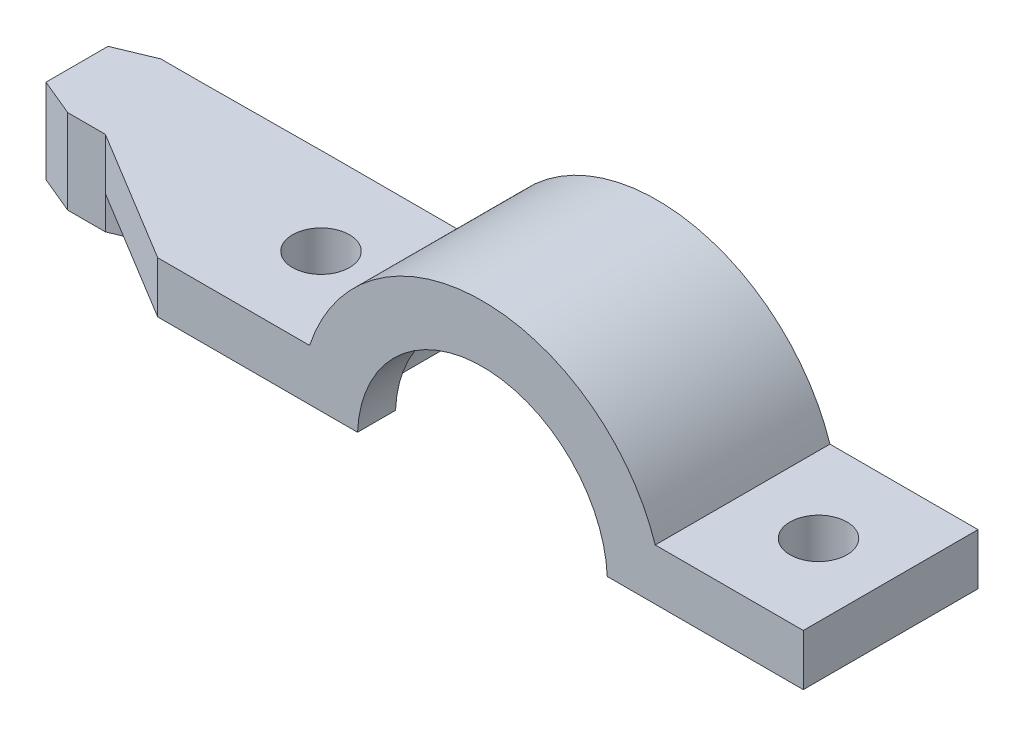
from build123d import *

# Parameters (mm, degrees)
REVOLVE_1_ANGLE       = 180
SKETCH_3_W            = 9
SKETCH_3_H            = 9.2
SKETCH_3_R            = 1.5
EXTRUDE_2_DEPTH       = 3
MOVE_FACE_1_OUTLINE_W = 34.2
MOVE_FACE_1_OUTLINE_H = 9.2
MOVE_FACE_1_OUTLINE_R = 1.5
MOVE_FACE_1_DEPTH     = 0.3
EXTRUDE_3_DEPTH       = 2.7
EXTRUDE_4_DEPTH       = 4.45
EXTRUDE_5_DEPTH       = 1.45
MOVE_FACE_2_BY        = 0.2


# Read off the part's stored shape, not the designer's step: Переместить грань1
with BuildPart() as part:
    # Эскиз2 → Повернуть1 (revolve)
    with BuildSketch(Plane(origin=(0, 0, 0), x_dir=(1, 0, 0), z_dir=(0, 1, 0))):
        Polygon((6.583922431, -16.610594473), (6.583922431, -14.610594473), (9.583922431, -14.610594473), (9.583922431, -23.810594473), (6.583922431, -23.810594473), (6.583922431, -21.810594473), (7.783922431, -21.810594473), (8.1, -21.132763939), (8.1, -17.288425007), (7.783922431, -16.610594473), align=None)
    revolve(axis=Axis((0, 0, 1.686216313), (0, 0, 1)), revolution_arc=REVOLVE_1_ANGLE)

    # Эскиз3 → Бобышка-Вытянуть2 (add)
    # profile 1 of 2: a face of its own
    with BuildSketch(Plane(origin=(0, 0, 0), x_dir=(1, 0, 0), z_dir=(0, 1, 0))):
        with Locations((12.6, -19.210594473)):
            Rectangle(SKETCH_3_W, SKETCH_3_H)
        with Locations(Location((13.1, -19.210594473, 0), (0, 0, 270))):
            Circle(SKETCH_3_R, mode=Mode.SUBTRACT)
    # profile 2 of 2: a face of its own
    with BuildSketch(Plane(origin=(0, 0, 0), x_dir=(1, 0, 0), z_dir=(0, 1, 0))):
        with Locations((-12.6, -19.210594473)):
            Rectangle(SKETCH_3_W, SKETCH_3_H)
        with Locations(Location((-13.1, -19.210594473, 0), (0, 0, 90))):
            Circle(SKETCH_3_R, mode=Mode.SUBTRACT)
    extrude(amount=EXTRUDE_2_DEPTH)

    # Move Face 1 outline → Move Face 1 (cut)
    with BuildSketch(Plane(origin=(0, 0, 0), x_dir=(1, 0, 0), z_dir=(0, 1, 0))):
        with Locations((0, -19.210594473)):
            Rectangle(MOVE_FACE_1_OUTLINE_W, MOVE_FACE_1_OUTLINE_H)
        with Locations((-13.1, -19.210594473)):
            Circle(MOVE_FACE_1_OUTLINE_R, mode=Mode.SUBTRACT)
        with Locations((13.1, -19.210594473)):
            Circle(MOVE_FACE_1_OUTLINE_R, mode=Mode.SUBTRACT)
    extrude(amount=MOVE_FACE_1_DEPTH, mode=Mode.SUBTRACT)

    # Эскиз4 → Бобышка-Вытянуть3 (add)
    with BuildSketch(Plane(origin=(0, 3, 0), x_dir=(1, 0, 0), z_dir=(0, 1, 0))):
        Polygon((-24.11, -14.660594473), (-17.1, -14.610594473), (-17.1, -23.810594473), (-24.11, -19.560594473), (-26.09, -19.560594473), (-28.05, -18.743927806), (-28.05, -15.47726114), (-26.09, -14.660594473), align=None)
        Polygon((-27.25, -16.010594473), (-27.25, -18.210594473), (-25.93, -18.760594473), (-24.27, -18.760594473), (-22.95, -18.210594473), (-22.95, -16.010594473), (-24.27, -15.460594473), (-25.93, -15.460594473), align=None, mode=Mode.SUBTRACT)
    extrude(amount=-EXTRUDE_3_DEPTH)

    # Эскиз5 → Бобышка-Вытянуть4 (add)
    with BuildSketch(Plane(origin=(0, 3, 0), x_dir=(1, 0, 0), z_dir=(0, 1, 0))):
        Polygon((-28.05, -15.47726114), (-28.05, -18.743927806), (-26.09, -19.560594473), (-24.11, -19.560594473), (-22.15, -18.743927806), (-22.15, -15.47726114), (-24.11, -14.660594473), (-26.09, -14.660594473), align=None)
        Polygon((-27.25, -16.010594473), (-27.25, -18.210594473), (-25.93, -18.760594473), (-24.27, -18.760594473), (-22.95, -18.210594473), (-22.95, -16.010594473), (-24.27, -15.460594473), (-25.93, -15.460594473), align=None, mode=Mode.SUBTRACT)
    extrude(amount=-EXTRUDE_4_DEPTH)

    # Эскиз5<2> → Бобышка-Вытянуть5 (add)
    with BuildSketch(Plane(origin=(0, 3, 0), x_dir=(1, 0, 0), z_dir=(0, 1, 0))):
        Polygon((-25.93, -15.460594473), (-27.25, -16.010594473), (-27.25, -18.210594473), (-25.93, -18.760594473), (-24.27, -18.760594473), (-22.95, -18.210594473), (-22.95, -16.010594473), (-24.27, -15.460594473), align=None)
    extrude(amount=-EXTRUDE_5_DEPTH)

    # Move Face 2: a face moved inward by 0.2
    extrude(part.faces().sort_by_distance((17.1, 1.65, 19.210594473))[0], amount=MOVE_FACE_2_BY, dir=(-1, 0, 0), mode=Mode.SUBTRACT)


solid = part.part
